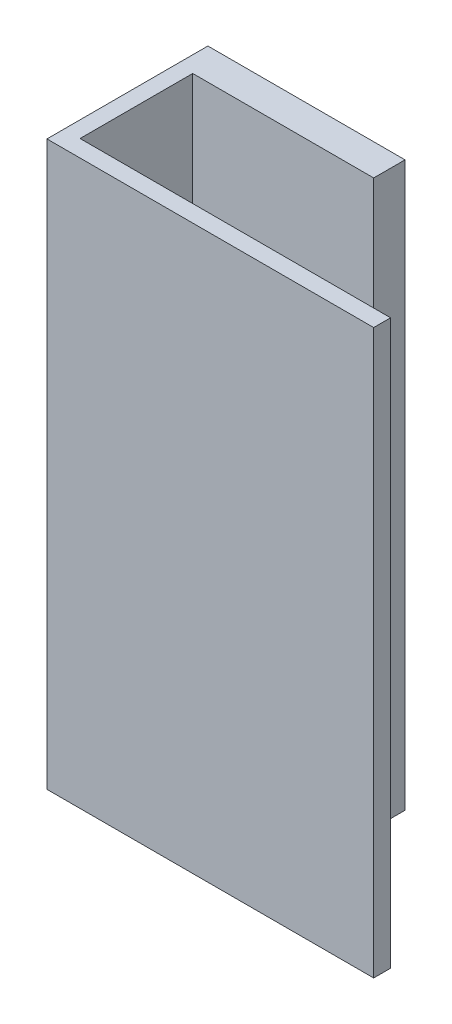
from build123d import *

# Parameters (mm, degrees)
SKETCH2_W           = 106
SKETCH2_H           = 106
SKETCH2_R           = 4
SKETCH2_R_2         = 6
BOSS_EXTRUDE1_DEPTH = 25
SKETCH3_W           = 106
SKETCH3_H           = 106
SKETCH3_W_2         = 100
SKETCH3_H_2         = 100
BOSS_EXTRUDE2_DEPTH = 20
SKETCH5_W           = 3
SKETCH5_H           = 23
BOSS_EXTRUDE3_DEPTH = 20
SKETCH7_W           = 20
SKETCH7_H           = 3
BOSS_EXTRUDE4_DEPTH = 20
SKETCH9_R           = 9.905763918
CUT_EXTRUDE1_DEPTH  = 10
SKETCH10_W          = 10
SKETCH10_H          = 4
BOSS_EXTRUDE5_DEPTH = 10
SKETCH11_W          = 10
SKETCH11_H          = 4
BOSS_EXTRUDE6_DEPTH = 10
FILLET2_RADIUS      = 5
FILLET2_LENGTH      = 4
FILLET3_R           = 5
FILLET4_R           = 5
FILLET5_R           = 5
SKETCH13_R          = 1.6
CUT_EXTRUDE2_DEPTH  = 163.397660082
SKETCH14_W          = 35.96051594
SKETCH14_H          = 7.693498276
CUT_EXTRUDE3_DEPTH  = 30
BOSS_EXTRUDE7_DEPTH = 100
SKETCH21_W          = 151.44967638
SKETCH21_H          = 134.741704964
CUT_EXTRUDE6_DEPTH  = 187.257885739


with BuildPart() as part:
    # Sketch2 → Boss-Extrude1 (new body)
    with BuildSketch(Plane(origin=(0, 0, 0), x_dir=(1, 0, 0), z_dir=(0, 1, 0))):
        with Locations((53, 53)):
            Rectangle(SKETCH2_W, SKETCH2_H)
        with Locations(Location((18, 15, 0), (0, 0, 270))):
            Circle(SKETCH2_R, mode=Mode.SUBTRACT)
        with Locations(Location((92, 13.5, 0), (0, 0, 270))):
            Circle(SKETCH2_R_2, mode=Mode.SUBTRACT)
    extrude(amount=BOSS_EXTRUDE1_DEPTH)

    # Sketch3 → Boss-Extrude2 (add)
    with BuildSketch(Plane(origin=(0, 25, 0), x_dir=(1, 0, 0), z_dir=(0, 1, 0))):
        with Locations((53, 53)):
            Rectangle(SKETCH3_W, SKETCH3_H)
        with Locations((53, 53)):
            Rectangle(SKETCH3_W_2, SKETCH3_H_2, mode=Mode.SUBTRACT)
    extrude(amount=BOSS_EXTRUDE2_DEPTH)

    # Sketch5 → Boss-Extrude3 (add)
    with BuildSketch(Plane(origin=(0, 25, 0), x_dir=(1, 0, 0), z_dir=(0, 1, 0))):
        Polygon((3, 28), (3, 25), (32, 25), (32, 23), (35, 23), (35, 43), (32, 43), (32, 28), align=None)
        Polygon((83, 52.5), (83, 26.5), (76, 26.5), (76, 3), (73, 3), (73, 29.5), (80, 29.5), (80, 49.5), (73, 49.5), (73, 52.5), align=None)
        Polygon((3, 63), (3, 60), (25, 60), (25, 80), (22, 80), (22, 63), align=None)
        with Locations((59.5, 14.5)):
            Rectangle(SKETCH5_W, SKETCH5_H)
    extrude(amount=BOSS_EXTRUDE3_DEPTH)

    # Sketch7 → Boss-Extrude4 (add)
    with BuildSketch(Plane(origin=(0, 25, 0), x_dir=(1, 0, 0), z_dir=(0, 1, 0))):
        Polygon((50, 70.496538655), (53, 70.496538655), (53, 73.496538655), (53, 83.496538655), (50, 83.496538655), align=None)
        with Locations((63, 71.996538655)):
            Rectangle(SKETCH7_W, SKETCH7_H)
        Polygon((73, 70.496538655), (73, 52.5), (76, 52.5), (76, 82.5), (73, 82.5), (73, 73.496538655), align=None)
    extrude(amount=BOSS_EXTRUDE4_DEPTH)

    # Sketch9 → Cut-Extrude1 (cut)
    with BuildSketch(Plane(origin=(0, 25, 0), x_dir=(1, 0, 0), z_dir=(0, 1, 0))):
        with Locations(Location((92, 13.5, 0), (0, 0, 270))):
            Circle(SKETCH9_R)
    extrude(amount=-CUT_EXTRUDE1_DEPTH, mode=Mode.SUBTRACT)

    # Sketch10 → Boss-Extrude5 (add)
    with BuildSketch(Plane.XY):
        with Locations((53, 2)):
            Rectangle(SKETCH10_W, SKETCH10_H)
    extrude(amount=BOSS_EXTRUDE5_DEPTH)

    # Sketch11 → Boss-Extrude6 (add)
    with BuildSketch(Plane(origin=(0, 0, -106), x_dir=(-1, 0, 0), z_dir=(0, 0, -1))):
        with Locations((-53, 2)):
            Rectangle(SKETCH11_W, SKETCH11_H)
    extrude(amount=BOSS_EXTRUDE6_DEPTH)

    # Fillet2: full round fillet: the end face becomes a half cylinder, R = half its width
    fillet2_face = Plane((53, 2, -116), x_dir=(0, -1, 0), z_dir=(0, 0, -1))  # on the end face: x along it, z out of the body
    fillet2_slab = fillet2_face.offset(-FILLET2_RADIUS / 2) * Box(FILLET2_LENGTH, 2 * FILLET2_RADIUS, FILLET2_RADIUS, mode=Mode.PRIVATE)  # the body's end, R deep
    fillet2_round = Plane((53, 2, -111), x_dir=(0, 0, -1), z_dir=(0, -1, 0)) * Cylinder(FILLET2_RADIUS, FILLET2_LENGTH, mode=Mode.PRIVATE)  # its axis R under the face
    add(fillet2_slab - fillet2_round, mode=Mode.SUBTRACT)

    # Fillet3
    fillet3_edges = [part.edges().sort_by_distance(p)[0] for p in [
        (48, 2, -106),
        (58, 2, -106),
    ]]
    fillet(fillet3_edges, radius=FILLET3_R - 0.0001)  # a hair under: the kernel refuses the full size

    # Fillet4
    fillet4_edges = [part.edges().sort_by_distance(p)[0] for p in [
        (48, 2, 0),
        (58, 2, 0),
    ]]
    fillet(fillet4_edges, radius=FILLET4_R)

    # Fillet5
    fillet5_edges = [part.edges().sort_by_distance(p)[0] for p in [
        (48, 2, 10),
        (58, 2, 10),
    ]]
    fillet(fillet5_edges, radius=FILLET5_R - 0.0001)  # a hair under: the kernel refuses the full size

    # Sketch13 → Cut-Extrude2 (cut, through all)
    with BuildSketch(Plane(origin=(0, 4, 0), x_dir=(1, 0, 0), z_dir=(0, 1, 0))):
        with Locations(Location((53, -5, 0), (0, 0, 180))):
            Circle(SKETCH13_R)
        with Locations(Location((53, 111, 0), (0, 0, 180))):
            Circle(SKETCH13_R)
    extrude(amount=-CUT_EXTRUDE2_DEPTH, mode=Mode.SUBTRACT)

    # Sketch14 → Cut-Extrude3 (cut)
    with BuildSketch(Plane.XY):
        with Locations((88.01974203, 3.846749138)):
            Rectangle(SKETCH14_W, SKETCH14_H)
    extrude(amount=-CUT_EXTRUDE3_DEPTH, mode=Mode.SUBTRACT)

    # Sketch15 → Boss-Extrude7 (add)
    with BuildSketch(Plane(origin=(0, 45, 0), x_dir=(1, 0, 0), z_dir=(0, 1, 0))):
        Polygon((0, 28.5668375), (0, 0), (2.876085753, 0), (58, 0), (58, 3), (2.876085753, 3), (2.876085753, 23), (35, 23), (35, 28.5668375), align=None)
    extrude(amount=BOSS_EXTRUDE7_DEPTH)

    # Sketch21 → Cut-Extrude6 (cut, through all)
    with BuildSketch(Plane(origin=(0, 45, 0), x_dir=(1, 0, 0), z_dir=(0, 1, 0))):
        with Locations((51.832238557, 52.101721967)):
            Rectangle(SKETCH21_W, SKETCH21_H)
    extrude(amount=-CUT_EXTRUDE6_DEPTH, mode=Mode.SUBTRACT)


solid = part.part
